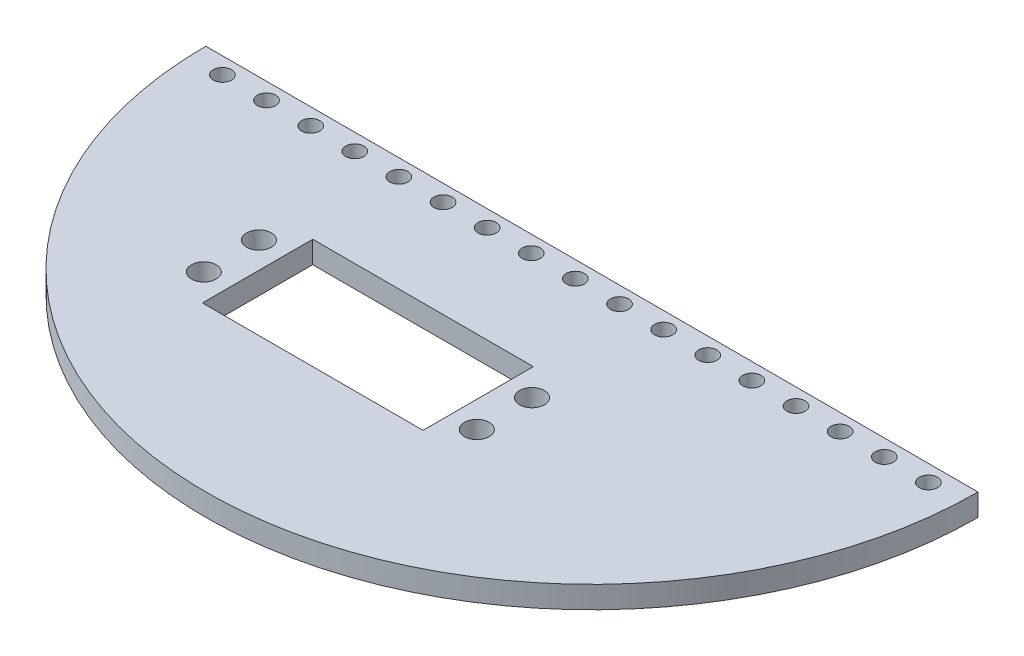
from build123d import *

# Parameters (mm, degrees)
EXTRUDE_1_DEPTH     = 4
CUT_EXTRUDE_1_DEPTH = 10
SKETCH_3_R          = 2.25
CUT_EXTRUDE_2_DEPTH = 10
SKETCH_4_R          = 1.65
CUT_EXTRUDE_3_DEPTH = 10
EXTRUDE_START       = -4
EXTRUDE_2_DEPTH     = 4
SKETCH_6_R          = 1.65
CUT_EXTRUDE_4_DEPTH = 4
SKETCH_7_W          = 40
SKETCH_7_H          = 10
SKETCH_7_R          = 2.25
CUT_EXTRUDE_5_DEPTH = 4
SKETCH_8_W          = 40
SKETCH_8_H          = 10
SKETCH_8_R          = 2.25
EXTRUDE_4_DEPTH     = 4


with BuildPart() as part:
    # 草图1 → 凸台-拉伸1 (new body)
    with BuildSketch(Plane(origin=(0, 0, 0), x_dir=(1, 0, 0), z_dir=(0, 1, 0))):
        with BuildLine():
            Line((-50, 0), (50, 0))
            ThreePointArc((50, 0), (0, -50), (-50, 0))
        make_face()
    extrude(amount=EXTRUDE_1_DEPTH)

    # 草图2 → 切除-拉伸1 (cut)
    with BuildSketch(Plane(origin=(0, 4, 0), x_dir=(1, 0, 0), z_dir=(0, 1, 0))):
        Polygon((0, -10.623043888), (10, -10.623043888), (10, -30.623043888), (-30, -30.623043888), (-30, -10.623043888), align=None)
    extrude(amount=-CUT_EXTRUDE_1_DEPTH, mode=Mode.SUBTRACT)

    # 草图3 → 切除-拉伸2 (cut)
    with BuildSketch(Plane(origin=(0, 4, 0), x_dir=(1, 0, 0), z_dir=(0, 1, 0))):
        with Locations((-34.75, -15.623043888)):
            Circle(SKETCH_3_R)
        with Locations((-34.75, -25.623043888)):
            Circle(SKETCH_3_R)
        with Locations((14.75, -25.623043888)):
            Circle(SKETCH_3_R)
        with Locations((14.75, -15.623043888)):
            Circle(SKETCH_3_R)
    extrude(amount=-CUT_EXTRUDE_2_DEPTH, mode=Mode.SUBTRACT)

    # 草图4 → 切除-拉伸3 (cut)
    with BuildSketch(Plane(origin=(0, 4, 0), x_dir=(1, 0, 0), z_dir=(0, 1, 0))):
        with Locations((0, -3)):
            Circle(SKETCH_4_R)
        with Locations((8, -3)):
            Circle(SKETCH_4_R)
        with Locations((16, -3)):
            Circle(SKETCH_4_R)
        with Locations((24, -3)):
            Circle(SKETCH_4_R)
        with Locations((32, -3)):
            Circle(SKETCH_4_R)
        with Locations((40, -3)):
            Circle(SKETCH_4_R)
        with Locations((-40, -3)):
            Circle(SKETCH_4_R)
        with Locations((-32, -3)):
            Circle(SKETCH_4_R)
        with Locations((-24, -3)):
            Circle(SKETCH_4_R)
        with Locations((-16, -3)):
            Circle(SKETCH_4_R)
        with Locations((-8, -3)):
            Circle(SKETCH_4_R)
    extrude(amount=-CUT_EXTRUDE_3_DEPTH, mode=Mode.SUBTRACT)

    # 草图5 → 凸台-拉伸2 (add)
    with BuildSketch(Plane(origin=(0, 4, 0), x_dir=(1, 0, 0), z_dir=(0, 1, 0)).offset(EXTRUDE_START)):
        with BuildLine():
            Line((-50, 0), (-70, 0))
            ThreePointArc((-70, 0), (0, -70), (70, 0))
            Line((70, 0), (50, 0))
            ThreePointArc((50, 0), (0, -50), (-50, 0))
        make_face()
    extrude(amount=EXTRUDE_2_DEPTH)

    # 草图6 → 切除-拉伸4 (cut)
    with BuildSketch(Plane(origin=(0, 4, 0), x_dir=(1, 0, 0), z_dir=(0, 1, 0))):
        with Locations((0, -3)):
            Circle(SKETCH_6_R)
        with Locations((8, -3)):
            Circle(SKETCH_6_R)
        with Locations((16, -3)):
            Circle(SKETCH_6_R)
        with Locations((24, -3)):
            Circle(SKETCH_6_R)
        with Locations((32, -3)):
            Circle(SKETCH_6_R)
        with Locations((40, -3)):
            Circle(SKETCH_6_R)
        with Locations((48, -3)):
            Circle(SKETCH_6_R)
        with Locations((56, -3)):
            Circle(SKETCH_6_R)
        with Locations((64, -3)):
            Circle(SKETCH_6_R)
        with Locations((-8, -3)):
            Circle(SKETCH_6_R)
        with Locations((-16, -3)):
            Circle(SKETCH_6_R)
        with Locations((-24, -3)):
            Circle(SKETCH_6_R)
        with Locations((-32, -3)):
            Circle(SKETCH_6_R)
        with Locations((-40, -3)):
            Circle(SKETCH_6_R)
        with Locations((-48, -3)):
            Circle(SKETCH_6_R)
        with Locations((-56, -3)):
            Circle(SKETCH_6_R)
        with Locations((-64, -3)):
            Circle(SKETCH_6_R)
    extrude(amount=-CUT_EXTRUDE_4_DEPTH, mode=Mode.SUBTRACT)

    # 草图7 → 切除-拉伸5 (cut)
    with BuildSketch(Plane(origin=(0, 4, 0), x_dir=(1, 0, 0), z_dir=(0, 1, 0))):
        with Locations((-10, -35.623043888)):
            Rectangle(SKETCH_7_W, SKETCH_7_H)
        with Locations((14.75, -35.623043888)):
            Circle(SKETCH_7_R)
        with Locations((-34.75, -35.623043888)):
            Circle(SKETCH_7_R)
    extrude(amount=-CUT_EXTRUDE_5_DEPTH, mode=Mode.SUBTRACT)

    # 草图8 → 凸台-拉伸4 (add)
    with BuildSketch(Plane(origin=(0, 4, 0), x_dir=(1, 0, 0), z_dir=(0, 1, 0))):
        with Locations((-10, -15.623043888)):
            Rectangle(SKETCH_8_W, SKETCH_8_H)
        with Locations((-34.75, -15.623043888)):
            Circle(SKETCH_8_R)
        with Locations((14.75, -15.623043888)):
            Circle(SKETCH_8_R)
    extrude(amount=-EXTRUDE_4_DEPTH)


solid = part.part
